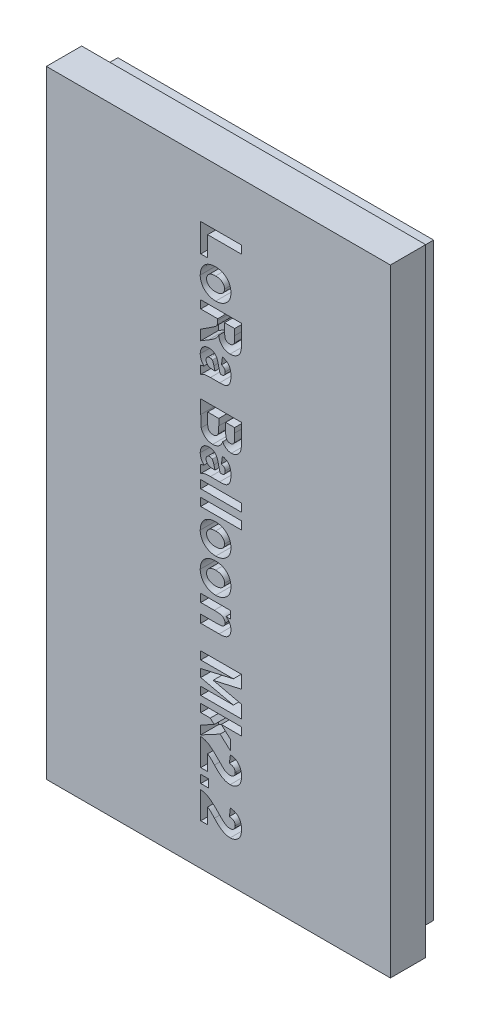
from build123d import *

# Parameters (mm, degrees)
SKETCH1_W   = 39
SKETCH1_H   = 70
BASE_DEPTH  = 4
SKETCH2_W   = 35.8
SKETCH2_H   = 66.8
SKETCH2_W_2 = 32.2
SKETCH2_H_2 = 63.2
MOUNT_DEPTH = 2.5
SKETCH3_W   = 4.622973633
SKETCH3_H   = 0.90057928
SKETCH3_H_2 = 0.900579279
SKETCH3_W_2 = 0.900579279
LOGO_DEPTH  = 2


with BuildPart() as part:
    # Sketch1 → Base (new body)
    with BuildSketch(Plane.XY):
        with Locations((19.5, 35)):
            Rectangle(SKETCH1_W, SKETCH1_H)
    extrude(amount=BASE_DEPTH)

    # Sketch2 → Mount (add)
    with BuildSketch(Plane(origin=(0, 0, 0), x_dir=(-1, 0, 0), z_dir=(0, 0, -1))):
        with Locations((-19.5, 35)):
            Rectangle(SKETCH2_W, SKETCH2_H)
        with Locations((-19.5, 35)):
            Rectangle(SKETCH2_W_2, SKETCH2_H_2, mode=Mode.SUBTRACT)
    extrude(amount=MOUNT_DEPTH)

    # Sketch3 → Logo (cut)
    # profile 1 of 16: a face of its own
    with BuildSketch(Plane.XY.offset(4)):
        Polygon((17.5, 63.519691051), (22.122973633, 63.519691051), (22.122973633, 62.619111772), (18.280502042, 62.619111772), (18.280502042, 60.337644265), (17.5, 60.337644265), align=None)
    # profile 2 of 16: a face of its own
    with BuildSketch(Plane.XY.offset(4)):
        with BuildLine():
            add(Edge.make_bspline(
                [(19.227986492, 59.917373935), (19.268340591, 59.916553667), (19.348241235, 59.914929545), (19.466831788, 59.904980589), (19.582597294, 59.885571908), (19.695714536, 59.860482277), (19.806416527, 59.82895916), (19.913363069, 59.787668503), (20.018572563, 59.741561532), (20.119538873, 59.686551332), (20.216642118, 59.627238007), (20.307982668, 59.562480077), (20.392270804, 59.492505889), (20.471764649, 59.420003428), (20.542963196, 59.340819709), (20.610173753, 59.25914226), (20.668761487, 59.17106248), (20.722741328, 59.080281515), (20.769340893, 58.984958843), (20.810963092, 58.887212626), (20.84421655, 58.785501626), (20.874003462, 58.682243794), (20.895076066, 58.575124144), (20.911226693, 58.46559476), (20.920807626, 58.352789526), (20.921733394, 58.276648926), (20.922201261, 58.23816882)],
                knots=[0, 0, 0, 0, 1.087797627, 2.153826546, 3.204146119, 4.249074796, 5.276002369, 6.302929943, 7.33671768, 8.369955531, 9.399197913, 10.402506754, 11.384561342, 12.350717656, 13.299250364, 14.252266119, 15.199037181, 16.147307724, 17.097187567, 18.056740571, 19.008264324, 19.97962709, 20.951574749, 21.948063114, 22.962987564, 24, 24, 24, 24], degree=3))
            add(Edge.make_bspline(
                [(20.922201261, 58.23816882), (20.920492435, 58.17431076), (20.917163302, 58.049902547), (20.89380331, 57.868435741), (20.853287611, 57.69781183), (20.797267351, 57.536975467), (20.72326136, 57.38733444), (20.634810544, 57.247019053), (20.529143938, 57.117967528), (20.40795289, 57.001818049), (20.277240101, 56.897040623), (20.139130934, 56.806096419), (19.996080966, 56.728621147), (19.847473094, 56.665454644), (19.693540221, 56.615077456), (19.533372162, 56.581373883), (19.368435672, 56.5582934), (19.256523789, 56.556247491), (19.199843389, 56.555211293)],
                knots=[0, 0, 0, 0, 1.136040707, 2.213233445, 3.248238065, 4.25119704, 5.236487175, 6.211911138, 7.196384178, 8.195725979, 9.1931767, 10.173001403, 11.133846892, 12.083513917, 13.042376269, 14.010298635, 14.992269034, 16, 16, 16, 16], degree=3))
            add(Edge.make_bspline(
                [(19.199843389, 56.555211293), (19.157599655, 56.555892607), (19.0738988, 56.557242549), (18.949923499, 56.569225625), (18.828866965, 56.586435452), (18.710806659, 56.612233079), (18.595913097, 56.644512826), (18.484212787, 56.68553559), (18.375843769, 56.733219222), (18.270645012, 56.787374854), (18.171228883, 56.848385325), (18.076479739, 56.912829759), (17.989613644, 56.983498286), (17.908343846, 57.057930632), (17.833120613, 57.136653742), (17.764474284, 57.22039727), (17.702322369, 57.308790164), (17.647348245, 57.401571301), (17.598380596, 57.497418925), (17.556075444, 57.596143647), (17.52061437, 57.69714263), (17.49154767, 57.800282717), (17.4673821, 57.905319168), (17.452433072, 58.013337566), (17.441007522, 58.123164342), (17.440311587, 58.197173674), (17.439961381, 58.234416407)],
                knots=[0, 0, 0, 0, 1.117558833, 2.214307803, 3.293244786, 4.351421184, 5.409597582, 6.448807362, 7.497331125, 8.540978692, 9.576922014, 10.582241184, 11.570837346, 12.537122916, 13.496974449, 14.449450387, 15.399839374, 16.353464778, 17.300823134, 18.246083241, 19.193441597, 20.131138339, 21.080698472, 22.042616426, 23.015011865, 24, 24, 24, 24], degree=3))
            add(Edge.make_bspline(
                [(17.439961381, 58.234416407), (17.441434818, 58.293581477), (17.444329398, 58.409811804), (17.466190044, 58.580403837), (17.502637169, 58.743113282), (17.553836141, 58.89819662), (17.618260134, 59.046016275), (17.698440035, 59.185734774), (17.79447105, 59.316576164), (17.902499007, 59.440250702), (18.024251963, 59.553385074), (18.159878703, 59.651084335), (18.308067385, 59.733312239), (18.468125433, 59.800916368), (18.640780217, 59.853364958), (18.825794291, 59.890561403), (19.022910429, 59.913321598), (19.158504181, 59.916000953), (19.227986492, 59.917373935)],
                knots=[0, 0, 0, 0, 1.024594995, 2.012826322, 2.973358778, 3.908543225, 4.837401023, 5.761810751, 6.69243552, 7.644223827, 8.602462928, 9.564551743, 10.532007457, 11.531954493, 12.568505162, 13.651979317, 14.796803673, 16, 16, 16, 16], degree=3))
        make_face()
        with BuildLine():
            add(Edge.make_bspline(
                [(19.181081321, 59.016794656), (19.140418132, 59.015985767), (19.061457429, 59.014415049), (18.946509384, 59.004834622), (18.839622498, 58.985121553), (18.739486697, 58.962179728), (18.647961982, 58.928237045), (18.563118232, 58.889661344), (18.486368037, 58.842211129), (18.418159022, 58.787894592), (18.358227437, 58.728430958), (18.305063926, 58.666277416), (18.260023454, 58.601076499), (18.223835025, 58.532291004), (18.195763008, 58.46081815), (18.174765469, 58.386120438), (18.162389452, 58.308317825), (18.161082475, 58.255410656), (18.160424805, 58.228787786)],
                knots=[0, 0, 0, 0, 1.347985487, 2.617548842, 3.817114289, 4.948286482, 6.017057593, 7.046407217, 8.032969353, 8.999289909, 9.930051738, 10.827140183, 11.706817169, 12.550594062, 13.397420762, 14.247349517, 15.118066881, 16, 16, 16, 16], degree=3))
            add(Edge.make_bspline(
                [(18.160424805, 58.228787786), (18.161082172, 58.202789107), (18.162388524, 58.151123318), (18.174768649, 58.075184814), (18.195758212, 58.002347429), (18.224167513, 57.93213144), (18.260561859, 57.864498818), (18.306359128, 57.800600759), (18.359147439, 57.739085743), (18.42010437, 57.68129455), (18.488357165, 57.627164406), (18.565874129, 57.581398416), (18.650982245, 57.542984668), (18.743354127, 57.51120928), (18.843361939, 57.485665346), (18.951359004, 57.468256351), (19.067059726, 57.458032174), (19.146662829, 57.456552441), (19.187648045, 57.455790572)],
                knots=[0, 0, 0, 0, 0.86498205, 1.718932724, 2.552529207, 3.383717481, 4.236080589, 5.102502034, 5.995588818, 6.930639414, 7.894730959, 8.889086482, 9.918564038, 10.998334367, 12.1369617, 13.350269694, 14.635734454, 16, 16, 16, 16], degree=3))
            add(Edge.make_bspline(
                [(19.187648045, 57.455790572), (19.227688932, 57.456588782), (19.305407142, 57.458138086), (19.418448526, 57.467853118), (19.523973479, 57.487150925), (19.622320571, 57.511914829), (19.713524667, 57.543985128), (19.797316766, 57.58327715), (19.873991238, 57.630272105), (19.942107737, 57.685034462), (20.003044034, 57.743795675), (20.055828048, 57.806243808), (20.101619145, 57.87108965), (20.138009283, 57.939653741), (20.166408615, 58.010806032), (20.187393837, 58.084578407), (20.199774112, 58.161447567), (20.201080471, 58.21373417), (20.201737837, 58.240045027)],
                knots=[0, 0, 0, 0, 1.337232047, 2.595528913, 3.783536199, 4.915617704, 5.97906533, 7.006690339, 8.000659516, 8.974235141, 9.919454987, 10.823278711, 11.700968276, 12.565199868, 13.408680491, 14.254935835, 15.121875735, 16, 16, 16, 16], degree=3))
            add(Edge.make_bspline(
                [(20.201737837, 58.240045027), (20.201125638, 58.266363218), (20.199923414, 58.318046388), (20.187117275, 58.394207937), (20.1666105, 58.467170456), (20.137959369, 58.53762355), (20.10165055, 58.605310335), (20.055496899, 58.669222471), (20.003354012, 58.731596732), (19.942036507, 58.789412202), (19.873587127, 58.843503766), (19.796542842, 58.889985729), (19.712370979, 58.929796557), (19.620397249, 58.961484494), (19.521262796, 58.98667956), (19.414268616, 59.004448634), (19.300102491, 59.014500587), (19.221439565, 59.016016772), (19.181081321, 59.016794656)],
                knots=[0, 0, 0, 0, 0.8777483, 1.723705717, 2.56959874, 3.403036217, 4.257705828, 5.126471818, 6.029908573, 6.967489424, 7.934189811, 8.936630112, 9.963815147, 11.036651848, 12.178360317, 13.374360467, 14.652907978, 16, 16, 16, 16], degree=3))
        make_face(mode=Mode.SUBTRACT)
    # profile 3 of 16: a face of its own
    with BuildSketch(Plane.XY.offset(4)):
        with BuildLine():
            Line((17.5, 55.834747869), (22.122973633, 55.834747869))
            Line((22.122973633, 55.834747869), (22.122973633, 53.931336039))
            add(Edge.make_bspline(
                [(22.122973633, 53.931336039), (22.122603462, 53.872546069), (22.121890503, 53.759314846), (22.116763364, 53.595968956), (22.105883787, 53.445890968), (22.093695487, 53.308683291), (22.075788291, 53.184747794), (22.054389036, 53.07355638), (22.02973767, 52.975250916), (21.991190656, 52.86232027), (21.927918547, 52.73590191), (21.829831137, 52.599074998), (21.709116511, 52.475953385), (21.591346034, 52.386968918), (21.487257539, 52.325280846), (21.404923358, 52.283439484), (21.317857299, 52.250098354), (21.227356033, 52.221689731), (21.133020602, 52.199279165), (21.034598303, 52.183293809), (20.932711672, 52.173783072), (20.863433738, 52.17285937), (20.828390919, 52.172392134)],
                knots=[0, 0, 0, 0, 1.403336213, 2.702867097, 3.89994726, 4.994709233, 5.990128961, 6.887471613, 7.696701944, 8.407207329, 9.732421867, 11.053910544, 12.410433107, 13.833109191, 14.562763883, 15.297137368, 16.03453921, 16.78526912, 17.560138056, 18.346710252, 19.163717375, 20, 20, 20, 20], degree=3))
            add(Edge.make_bspline(
                [(20.828390919, 52.172392134), (20.784249276, 52.173152122), (20.697885971, 52.17463904), (20.571821786, 52.19038499), (20.45195708, 52.21403639), (20.339297604, 52.249508681), (20.231984451, 52.291952276), (20.132497639, 52.347135765), (20.039105913, 52.411113631), (19.952432097, 52.48444969), (19.87351831, 52.567423037), (19.802330467, 52.658794234), (19.737810759, 52.757581763), (19.682936532, 52.865615406), (19.633581682, 52.98093702), (19.593807931, 53.105487545), (19.560681473, 53.237717693), (19.545373295, 53.32925955), (19.537560619, 53.375978817)],
                knots=[0, 0, 0, 0, 1.084141299, 2.12112686, 3.117250271, 4.082180618, 5.019674211, 5.948149429, 6.871043381, 7.797863675, 8.732676681, 9.679570512, 10.640822351, 11.627176691, 12.653315453, 13.72007994, 14.836420889, 16, 16, 16, 16], degree=3))
            add(Edge.make_bspline(
                [(19.537560619, 53.375978817), (19.508484087, 53.327420021), (19.451853997, 53.232845847), (19.358336472, 53.100939278), (19.261317569, 52.981707751), (19.174212653, 52.890871561), (19.097310292, 52.821625001), (19.0295238, 52.766448195), (18.951540268, 52.707420675), (18.862838653, 52.644481945), (18.763722605, 52.577189453), (18.653874446, 52.505987708), (18.533375015, 52.430769254), (18.449117336, 52.379912075), (18.405269796, 52.353446093)],
                knots=[0, 0, 0, 0, 1.316447784, 2.563942512, 3.758196669, 4.89017242, 5.487731481, 6.164970468, 6.923081098, 7.76291089, 8.695186333, 9.710230341, 10.808408125, 12, 12, 12, 12], degree=3))
            Line((18.405269796, 52.353446093), (17.5, 51.812160423))
            Line((17.5, 51.812160423), (17.5, 52.95383228))
            Line((17.5, 52.95383228), (18.495327724, 53.594556913))
            add(Edge.make_bspline(
                [(18.495327724, 53.594556913), (18.538170903, 53.622381996), (18.619855584, 53.675433219), (18.736113095, 53.751052306), (18.839709613, 53.820173631), (18.931509766, 53.880939595), (19.009413932, 53.937271757), (19.075916224, 53.984397728), (19.12987976, 54.024862821), (19.184272621, 54.068912267), (19.238866246, 54.121356183), (19.293796286, 54.18457256), (19.336920929, 54.250578408), (19.370530988, 54.321019242), (19.39451614, 54.403545626), (19.410428062, 54.503019432), (19.418952624, 54.622883951), (19.420435996, 54.709323008), (19.421235795, 54.755928941)],
                knots=[0, 0, 0, 0, 1.540630534, 2.937361724, 4.182336204, 5.296545873, 6.256860607, 7.081241145, 7.754565199, 8.290682583, 9.191113071, 10.033949391, 10.810788607, 11.561665679, 12.379113064, 13.39303176, 14.594383257, 16, 16, 16, 16], degree=3))
            Line((19.421235795, 54.755928941), (19.421235795, 54.93416859))
            Line((19.421235795, 54.93416859), (17.5, 54.93416859))
            Line((17.5, 54.93416859), (17.5, 55.834747869))
        make_face()
        with BuildLine():
            Line((20.201737837, 54.93416859), (20.201737837, 54.273743786))
            add(Edge.make_bspline(
                [(20.201737837, 54.273743786), (20.201999563, 54.225587847), (20.20249754, 54.133962899), (20.203997976, 54.003230593), (20.207918581, 53.886279269), (20.212519213, 53.783074596), (20.217812844, 53.693574506), (20.224943188, 53.617787775), (20.23420104, 53.555806365), (20.24734485, 53.49201719), (20.271407064, 53.424655662), (20.311858966, 53.353327902), (20.361639607, 53.288286701), (20.424349944, 53.232785424), (20.498156922, 53.186888836), (20.583996569, 53.155374934), (20.680596319, 53.136459226), (20.748558268, 53.134198807), (20.784300059, 53.133010032)],
                knots=[0, 0, 0, 0, 1.560937284, 2.96995135, 4.237567709, 5.353650601, 6.318464703, 7.143454388, 7.820048429, 8.348858403, 9.25293029, 10.124191563, 10.998043079, 11.895328271, 12.823620657, 13.798761283, 14.842349086, 16, 16, 16, 16], degree=3))
            add(Edge.make_bspline(
                [(20.784300059, 53.133010032), (20.81847221, 53.134245883), (20.883936766, 53.136613436), (20.976941065, 53.155158092), (21.059506611, 53.187182262), (21.130758936, 53.23301968), (21.191421011, 53.289971409), (21.24112854, 53.356768373), (21.282982152, 53.431399448), (21.299994907, 53.486582477), (21.308699868, 53.514818122)],
                knots=[0, 0, 0, 0, 1.164311867, 2.230505154, 3.21629184, 4.165493112, 5.100643873, 6.036584124, 6.995373831, 8, 8, 8, 8], degree=3))
            add(Edge.make_bspline(
                [(21.308699868, 53.514818122), (21.311320199, 53.527617067), (21.317551044, 53.558051486), (21.324877556, 53.611570435), (21.329832618, 53.679873062), (21.334583807, 53.762748434), (21.338086886, 53.860333551), (21.341182461, 53.972906446), (21.341427788, 54.100196665), (21.342111742, 54.189940649), (21.342471591, 54.237157752)],
                knots=[0, 0, 0, 0, 0.432971861, 1.029557334, 1.788740938, 2.702316591, 3.781055348, 5.025222918, 6.434877167, 8, 8, 8, 8], degree=3))
            Line((21.342471591, 54.237157752), (21.342471591, 54.93416859))
            Line((21.342471591, 54.93416859), (20.201737837, 54.93416859))
        make_face(mode=Mode.SUBTRACT)
    # profile 4 of 16: a face of its own
    with BuildSketch(Plane.XY.offset(4)):
        with BuildLine():
            Line((19.841506126, 50.61138805), (19.961583363, 51.451928711))
            add(Edge.make_bspline(
                [(19.961583363, 51.451928711), (20.003056427, 51.440020111), (20.08373433, 51.416854211), (20.198162111, 51.373136266), (20.30438426, 51.325709527), (20.401073835, 51.270902191), (20.489620864, 51.211489282), (20.568113139, 51.144980211), (20.637964286, 51.07344571), (20.699606916, 50.99601388), (20.752828321, 50.910954703), (20.798705368, 50.817942481), (20.837141958, 50.716108782), (20.867740873, 50.60578658), (20.892075182, 50.486988816), (20.909807303, 50.359486045), (20.919932697, 50.223177629), (20.921430674, 50.129532389), (20.922201261, 50.081359621)],
                knots=[0, 0, 0, 0, 1.125515524, 2.189474865, 3.193709533, 4.158305409, 5.086274303, 5.972285183, 6.837881566, 7.691743787, 8.549806887, 9.451203831, 10.393874208, 11.385866739, 12.435713252, 13.556277782, 14.742906037, 16, 16, 16, 16], degree=3))
            add(Edge.make_bspline(
                [(20.922201261, 50.081359621), (20.921986052, 50.038506543), (20.921567926, 49.9552477), (20.914195236, 49.834230246), (20.905701633, 49.720830457), (20.891648419, 49.615270623), (20.872802431, 49.517635474), (20.850656262, 49.42762641), (20.824366297, 49.345482), (20.785361186, 49.248588079), (20.72686919, 49.141789781), (20.645227411, 49.029792983), (20.550150903, 48.93865795), (20.460504459, 48.877402987), (20.378336951, 48.83955966), (20.305144759, 48.816000272), (20.220833774, 48.79526852), (20.12519058, 48.778860098), (20.01811083, 48.765903154), (19.899799318, 48.756781831), (19.770265296, 48.75115149), (19.680158536, 48.750519763), (19.633247167, 48.750190874)],
                knots=[0, 0, 0, 0, 1.172645795, 2.278322549, 3.317437237, 4.284552983, 5.190951134, 6.037858116, 6.820064311, 7.549551753, 8.893788561, 10.141635195, 11.328036199, 12.481663495, 13.094362176, 13.79803918, 14.582676335, 15.469136844, 16.45214095, 17.533908717, 18.716103928, 20, 20, 20, 20], degree=3))
            Line((19.633247167, 48.750190874), (18.599457203, 48.757695701))
            add(Edge.make_bspline(
                [(18.599457203, 48.757695701), (18.564435728, 48.757403719), (18.496576972, 48.756837966), (18.398330909, 48.755681196), (18.307040045, 48.750474743), (18.222621106, 48.744792865), (18.144878475, 48.739106667), (18.074326469, 48.729015709), (18.010639761, 48.719369923), (17.934153527, 48.702680168), (17.841504636, 48.67487694), (17.729923806, 48.631472915), (17.614669352, 48.576902525), (17.539082625, 48.532826305), (17.5, 48.510036399)],
                knots=[0, 0, 0, 0, 1.100960395, 2.13325684, 3.08799504, 3.974623839, 4.793377983, 5.537123068, 6.214225653, 6.817686965, 7.996461938, 9.250537039, 10.578371695, 12, 12, 12, 12], degree=3))
            Line((17.5, 48.510036399), (17.5, 49.410615678))
            Line((17.5, 49.410615678), (17.867736539, 49.520373778))
            add(Edge.make_bspline(
                [(17.867736539, 49.520373778), (17.83226304, 49.556591272), (17.763238807, 49.627063168), (17.674416477, 49.742170854), (17.599695505, 49.860344522), (17.540260444, 49.983200312), (17.494849843, 50.10999856), (17.463178517, 50.240511108), (17.443827041, 50.375032633), (17.441261018, 50.465917722), (17.439961381, 50.511949088)],
                knots=[0, 0, 0, 0, 1.094238684, 2.129166538, 3.133671034, 4.10942336, 5.070833053, 6.037377746, 7.005973528, 8, 8, 8, 8], degree=3))
            add(Edge.make_bspline(
                [(17.439961381, 50.511949088), (17.441007341, 50.549813025), (17.443061457, 50.624172367), (17.454903777, 50.733206179), (17.476538098, 50.836821689), (17.507054288, 50.934832823), (17.543951561, 51.028430924), (17.591661801, 51.116031558), (17.646964549, 51.198837941), (17.71053094, 51.275834447), (17.781922723, 51.344520407), (17.857738316, 51.406912183), (17.941277911, 51.456774609), (18.028844016, 51.500371802), (18.123266364, 51.531264195), (18.222597532, 51.555303125), (18.327631273, 51.569376344), (18.399600412, 51.571119046), (18.436227209, 51.572005948)],
                knots=[0, 0, 0, 0, 1.111028414, 2.181900458, 3.212888925, 4.21115239, 5.190734394, 6.159429897, 7.131421471, 8.108723925, 9.081883785, 10.034678926, 10.981892532, 11.929727932, 12.898727489, 13.888948844, 14.925636122, 16, 16, 16, 16], degree=3))
            add(Edge.make_bspline(
                [(18.436227209, 51.572005948), (18.482593242, 51.570570747), (18.572724924, 51.567780835), (18.703283791, 51.545991429), (18.824622959, 51.509589158), (18.936022841, 51.457337912), (19.037479655, 51.39257465), (19.129142785, 51.315722556), (19.208842276, 51.225745591), (19.267148448, 51.141322735), (19.309753926, 51.065822541), (19.338835724, 50.999600706), (19.369441505, 50.926842835), (19.396985309, 50.845322297), (19.425368881, 50.756348095), (19.452494502, 50.659084561), (19.4774731, 50.553428176), (19.493569489, 50.48038811), (19.501912689, 50.442529436)],
                knots=[0, 0, 0, 0, 1.294162278, 2.515743014, 3.684113667, 4.820865117, 5.939906549, 7.036651616, 8.149715676, 9.285662014, 9.895437351, 10.567486448, 11.303637924, 12.098932185, 12.968810962, 13.91153998, 14.917493754, 16, 16, 16, 16], degree=3))
            add(Edge.make_bspline(
                [(19.501912689, 50.442529436), (19.511407002, 50.396831191), (19.529650374, 50.309021778), (19.559131352, 50.183149311), (19.587017816, 50.068002884), (19.61413993, 49.963436659), (19.640930358, 49.869757609), (19.668501435, 49.787074691), (19.694085633, 49.714833804), (19.712787099, 49.671017361), (19.721428888, 49.650770153)],
                knots=[0, 0, 0, 0, 1.361164628, 2.615484881, 3.770095419, 4.816364149, 5.765912261, 6.610903979, 7.358110453, 8, 8, 8, 8], degree=3))
            add(Edge.make_bspline(
                [(19.721428888, 49.650770153), (19.76207844, 49.651429427), (19.835936364, 49.652627291), (19.93546068, 49.657961407), (20.012171286, 49.66950181), (20.070146149, 49.685642352), (20.113156329, 49.712229682), (20.150196809, 49.74408205), (20.18179134, 49.785492699), (20.210776693, 49.83420177), (20.234039299, 49.892955807), (20.250744994, 49.962036374), (20.259418855, 50.041742371), (20.260957962, 50.098226609), (20.261776456, 50.128264791)],
                knots=[0, 0, 0, 0, 1.704637254, 3.09722893, 4.172654963, 4.956246112, 5.596985007, 6.275246559, 6.99385986, 7.769515704, 8.645866914, 9.631493719, 10.740434052, 12, 12, 12, 12], degree=3))
            add(Edge.make_bspline(
                [(20.261776456, 50.128264791), (20.260884607, 50.159017067), (20.25919465, 50.217289276), (20.241526382, 50.299374461), (20.215410217, 50.372126763), (20.174002857, 50.43472478), (20.117664666, 50.489569205), (20.042764104, 50.536922131), (19.949087652, 50.578793394), (19.879011929, 50.60002468), (19.841506126, 50.61138805)],
                knots=[0, 0, 0, 0, 1.045871977, 1.981813381, 2.848317391, 3.663751395, 4.514929533, 5.507645304, 6.666046366, 8, 8, 8, 8], degree=3))
        make_face()
        with BuildLine():
            add(Edge.make_bspline(
                [(19.121042702, 49.650770153), (19.111478433, 49.678227344), (19.090198568, 49.739317777), (19.059474829, 49.841940313), (19.027018533, 49.965053874), (19.005193715, 50.054117219), (18.993460638, 50.101997896)],
                knots=[0, 0, 0, 0, 0.743632693, 1.654533494, 2.73907137, 4, 4, 4, 4], degree=3))
            add(Edge.make_bspline(
                [(18.993460638, 50.101997896), (18.98653897, 50.130215888), (18.97332241, 50.184096661), (18.950053418, 50.260430744), (18.928514853, 50.329717913), (18.904326783, 50.390991339), (18.881777826, 50.445420249), (18.857166421, 50.491799098), (18.832210074, 50.530622659), (18.813567384, 50.552457403), (18.804901851, 50.562606673)],
                knots=[0, 0, 0, 0, 1.388607462, 2.65147299, 3.814389992, 4.855436495, 5.799565367, 6.62877246, 7.362623276, 8, 8, 8, 8], degree=3))
            add(Edge.make_bspline(
                [(18.804901851, 50.562606673), (18.787150786, 50.579491216), (18.752087496, 50.612842884), (18.686643373, 50.646727282), (18.614581201, 50.668200293), (18.563658271, 50.670332939), (18.537542378, 50.671426669)],
                knots=[0, 0, 0, 0, 0.985740837, 1.947112291, 2.947173789, 4, 4, 4, 4], degree=3))
            add(Edge.make_bspline(
                [(18.537542378, 50.671426669), (18.50766342, 50.670137856), (18.449801672, 50.667642019), (18.366786442, 50.643682117), (18.290760217, 50.606342092), (18.224593068, 50.553149627), (18.168585191, 50.490429239), (18.129814521, 50.416483471), (18.103890852, 50.33606052), (18.101569181, 50.279194172), (18.100386186, 50.250218235)],
                knots=[0, 0, 0, 0, 1.056198986, 2.045369905, 3.036276429, 4.038084886, 5.035473036, 5.992159802, 6.976916006, 8, 8, 8, 8], degree=3))
            add(Edge.make_bspline(
                [(18.100386186, 50.250218235), (18.101736527, 50.223223501), (18.104453435, 50.16890965), (18.124157539, 50.087854462), (18.156784545, 50.007731894), (18.200051148, 49.929484378), (18.252073425, 49.8576195), (18.311090427, 49.79663157), (18.374225547, 49.747093123), (18.432190619, 49.715163813), (18.484079963, 49.69628429), (18.530121172, 49.684823766), (18.5827991, 49.672932093), (18.642798398, 49.665245914), (18.709733915, 49.658557856), (18.78390109, 49.654068826), (18.865230729, 49.651253864), (18.921849407, 49.650935466), (18.951245984, 49.650770153)],
                knots=[0, 0, 0, 0, 1.093500888, 2.200141778, 3.360346716, 4.591280596, 5.815607582, 6.94487563, 8.019710678, 9.057444999, 9.610729159, 10.253199895, 10.979011171, 11.798077413, 12.702238226, 13.705425431, 14.808650418, 16, 16, 16, 16], degree=3))
            Line((18.951245984, 49.650770153), (19.121042702, 49.650770153))
        make_face(mode=Mode.SUBTRACT)
    # profile 5 of 16: a face of its own
    with BuildSketch(Plane.XY.offset(4)):
        with BuildLine():
            Line((22.122973633, 46.108491655), (22.122973633, 44.281066201))
            add(Edge.make_bspline(
                [(22.122973633, 44.281066201), (22.122521051, 44.221026579), (22.121651102, 44.105618856), (22.117632998, 43.939162972), (22.108005759, 43.786847256), (22.095757541, 43.648294778), (22.081840746, 43.523482495), (22.061533426, 43.412540908), (22.040180572, 43.315039471), (22.0049456, 43.204537428), (21.948462842, 43.080188598), (21.859088002, 42.944827325), (21.748544411, 42.821243994), (21.640427701, 42.730695394), (21.545807025, 42.665898527), (21.471963858, 42.622291391), (21.394724771, 42.586831753), (21.315529677, 42.557950869), (21.2346417, 42.533594529), (21.150572045, 42.51855641), (21.064475175, 42.507225139), (21.006044505, 42.506526476), (20.976611259, 42.506174538)],
                knots=[0, 0, 0, 0, 1.498327689, 2.88007457, 4.154414764, 5.305986542, 6.351317343, 7.286582663, 8.11946184, 8.840080679, 10.177555878, 11.512935148, 12.872513647, 14.301275782, 15.019863751, 15.733221227, 16.438466007, 17.137161526, 17.836031326, 18.543086972, 19.26611006, 20, 20, 20, 20], degree=3))
            add(Edge.make_bspline(
                [(20.976611259, 42.506174538), (20.922946761, 42.508244761), (20.817024149, 42.512330951), (20.662821857, 42.547652419), (20.51596526, 42.603079791), (20.380113254, 42.682270405), (20.256588311, 42.778484715), (20.148778926, 42.889289753), (20.056681459, 43.012718845), (20.011500867, 43.104508485), (19.988788362, 43.150651585)],
                knots=[0, 0, 0, 0, 1.031817477, 2.036594177, 3.029254201, 4.043130586, 5.050931669, 6.034203586, 7.01178454, 8, 8, 8, 8], degree=3))
            add(Edge.make_bspline(
                [(19.988788362, 43.150651585), (19.978291223, 43.119218071), (19.957542489, 43.057086323), (19.919057509, 42.967929238), (19.874445181, 42.88431553), (19.826159834, 42.80476423), (19.770442173, 42.731859613), (19.709973461, 42.664103109), (19.645321829, 42.600321355), (19.573797837, 42.544037104), (19.499063042, 42.491579361), (19.418797393, 42.447838091), (19.335071516, 42.410185621), (19.247401209, 42.378753037), (19.155229507, 42.355750252), (19.059306459, 42.33888402), (18.959608937, 42.328333414), (18.891858621, 42.326825057), (18.857435643, 42.326058683)],
                knots=[0, 0, 0, 0, 1.053917501, 2.08318216, 3.084375989, 4.067115349, 5.039987852, 5.998256831, 6.954975631, 7.924383767, 8.890110205, 9.856297623, 10.826929889, 11.808561028, 12.814635272, 13.844956918, 14.905053061, 16, 16, 16, 16], degree=3))
            add(Edge.make_bspline(
                [(18.857435643, 42.326058683), (18.815500063, 42.327003794), (18.733295748, 42.328856452), (18.612472135, 42.342119765), (18.496620731, 42.364499356), (18.385911071, 42.396523304), (18.279951486, 42.436913818), (18.179119697, 42.486864589), (18.083315073, 42.546315283), (17.992730779, 42.613589789), (17.90919217, 42.686948542), (17.833589227, 42.76465437), (17.765489185, 42.844869725), (17.707581308, 42.930073546), (17.656528591, 43.017258222), (17.61374927, 43.107736452), (17.581005615, 43.201992388), (17.565164633, 43.26652488), (17.557224308, 43.298871925)],
                knots=[0, 0, 0, 0, 1.145607172, 2.24567906, 3.316329682, 4.365460088, 5.390414304, 6.410550385, 7.434792233, 8.46684308, 9.489944109, 10.468671886, 11.426900475, 12.36059261, 13.279351643, 14.185149476, 15.09030244, 16, 16, 16, 16], degree=3))
            add(Edge.make_bspline(
                [(17.557224308, 43.298871925), (17.552629506, 43.325417983), (17.542179673, 43.385790953), (17.530238938, 43.48844883), (17.521967062, 43.613706564), (17.512784829, 43.761568824), (17.508239794, 43.932081832), (17.503113461, 44.125314849), (17.500511164, 44.34109826), (17.500175925, 44.492451827), (17.5, 44.57187826)],
                knots=[0, 0, 0, 0, 0.506837559, 1.152686718, 1.943271314, 2.868501158, 3.939884368, 5.152247396, 6.505573166, 8, 8, 8, 8], degree=3))
            Line((17.5, 44.57187826), (17.5, 46.108491655))
            Line((17.5, 46.108491655), (22.122973633, 46.108491655))
        make_face()
        with BuildLine():
            Line((21.342471591, 45.207912376), (20.321815075, 45.207912376))
            Line((20.321815075, 45.207912376), (20.321815075, 44.594392742))
            add(Edge.make_bspline(
                [(20.321815075, 44.594392742), (20.321708304, 44.55061401), (20.321505436, 44.467433178), (20.322860414, 44.349236777), (20.323271951, 44.244155796), (20.325612076, 44.152236417), (20.326868369, 44.073713296), (20.330184865, 44.008391975), (20.332255296, 43.956085536), (20.33545221, 43.925515906), (20.336824729, 43.912391559)],
                knots=[0, 0, 0, 0, 1.539755574, 2.925579234, 4.157432792, 5.235486124, 6.159601295, 6.919197766, 7.535983151, 8, 8, 8, 8], degree=3))
            add(Edge.make_bspline(
                [(20.336824729, 43.912391559), (20.342990913, 43.874641455), (20.354742688, 43.802695703), (20.388025395, 43.701846174), (20.433788831, 43.614182948), (20.491801151, 43.538937987), (20.562445267, 43.478974229), (20.646094328, 43.436974564), (20.740542137, 43.410987644), (20.807575483, 43.408203042), (20.84246247, 43.406753817)],
                knots=[0, 0, 0, 0, 1.156043088, 2.203236031, 3.197816213, 4.134692963, 5.061434266, 5.975433912, 6.946330216, 8, 8, 8, 8], degree=3))
            add(Edge.make_bspline(
                [(20.84246247, 43.406753817), (20.873876263, 43.407765583), (20.934019538, 43.409702659), (21.019351721, 43.431386426), (21.096016804, 43.464879192), (21.161935885, 43.513564177), (21.216357618, 43.571749905), (21.262093272, 43.635170819), (21.293723027, 43.705544152), (21.3117268, 43.770575939), (21.321477076, 43.833977643), (21.325841476, 43.900183126), (21.332380205, 43.98452942), (21.334869957, 44.08688744), (21.339580253, 44.207545593), (21.340377663, 44.346113349), (21.343094236, 44.5027625), (21.342686451, 44.613153063), (21.342471591, 44.671317222)],
                knots=[0, 0, 0, 0, 0.973031789, 1.862917975, 2.714444411, 3.555113712, 4.385861934, 5.180259999, 5.970734499, 6.766732084, 7.267820327, 7.959442945, 8.825288207, 9.893716152, 11.136763095, 12.573466007, 14.194578749, 16, 16, 16, 16], degree=3))
            Line((21.342471591, 44.671317222), (21.342471591, 45.207912376))
        make_face(mode=Mode.SUBTRACT)
        with BuildLine():
            Line((19.541313033, 45.207912376), (18.280502042, 45.207912376))
            Line((18.280502042, 45.207912376), (18.280502042, 44.367371715))
            add(Edge.make_bspline(
                [(18.280502042, 44.367371715), (18.280760428, 44.323280795), (18.281253401, 44.239160195), (18.282800025, 44.11937151), (18.286518536, 44.01209175), (18.291887116, 43.916971468), (18.299557696, 43.834126401), (18.307251331, 43.763556455), (18.317857629, 43.70572466), (18.331738252, 43.644979433), (18.35944942, 43.580071948), (18.402845831, 43.510176577), (18.458232543, 43.446158643), (18.525607831, 43.390276991), (18.604204685, 43.343759319), (18.693207476, 43.30987147), (18.79246554, 43.290066164), (18.861720576, 43.287837041), (18.897774089, 43.28667658)],
                knots=[0, 0, 0, 0, 1.468823539, 2.802352852, 3.990613231, 5.044577628, 5.97542194, 6.762296442, 7.407977832, 7.933490854, 8.834961323, 9.742609811, 10.665728169, 11.642033707, 12.646065455, 13.694610711, 14.799836276, 16, 16, 16, 16], degree=3))
            add(Edge.make_bspline(
                [(18.897774089, 43.28667658), (18.93476601, 43.288172532), (19.005924698, 43.291050187), (19.107872413, 43.311463924), (19.199388257, 43.34738452), (19.279963622, 43.397906582), (19.349625379, 43.459908308), (19.407243483, 43.532310286), (19.454309014, 43.613210713), (19.482516024, 43.689669667), (19.49973763, 43.760283467), (19.510234486, 43.826232908), (19.521102124, 43.904014), (19.527554048, 43.994593036), (19.534829997, 44.097100853), (19.5376358, 44.212266537), (19.540957195, 44.339522346), (19.541190876, 44.42865785), (19.541313033, 44.475253608)],
                knots=[0, 0, 0, 0, 1.143215143, 2.19912046, 3.197116365, 4.165365694, 5.123819291, 6.065802965, 7.014162653, 8.005206416, 8.5725482, 9.259043701, 10.068343003, 10.999502645, 12.064921609, 13.244816419, 14.559722402, 16, 16, 16, 16], degree=3))
            Line((19.541313033, 44.475253608), (19.541313033, 45.207912376))
        make_face(mode=Mode.SUBTRACT)
    # profile 6 of 16: a face of its own
    with BuildSketch(Plane.XY.offset(4)):
        with BuildLine():
            Line((19.841506126, 40.885131836), (19.961583363, 41.725672496))
            add(Edge.make_bspline(
                [(19.961583363, 41.725672496), (20.003056427, 41.713763896), (20.08373433, 41.690597996), (20.198162111, 41.646880052), (20.30438426, 41.599453313), (20.401073835, 41.544645976), (20.489620864, 41.485233068), (20.568113139, 41.418723997), (20.637964286, 41.347189496), (20.699606916, 41.269757665), (20.752828321, 41.184698488), (20.798705368, 41.091686266), (20.837141958, 40.989852568), (20.867740873, 40.879530366), (20.892075182, 40.760732601), (20.909807303, 40.633229831), (20.919932697, 40.496921414), (20.921430674, 40.403276175), (20.922201261, 40.355103406)],
                knots=[0, 0, 0, 0, 1.125515524, 2.189474865, 3.193709533, 4.158305409, 5.086274303, 5.972285183, 6.837881566, 7.691743787, 8.549806887, 9.451203831, 10.393874208, 11.385866739, 12.435713252, 13.556277782, 14.742906037, 16, 16, 16, 16], degree=3))
            add(Edge.make_bspline(
                [(20.922201261, 40.355103406), (20.921986052, 40.312250329), (20.921567926, 40.228991485), (20.914195236, 40.107974031), (20.905701633, 39.994574243), (20.891648419, 39.889014409), (20.872802431, 39.79137926), (20.850656262, 39.701370195), (20.824366297, 39.619225785), (20.785361186, 39.522331864), (20.72686919, 39.415533566), (20.645227411, 39.303536769), (20.550150903, 39.212401735), (20.460504459, 39.151146773), (20.378336951, 39.113303446), (20.305144759, 39.089744058), (20.220833774, 39.069012306), (20.12519058, 39.052603883), (20.01811083, 39.039646939), (19.899799318, 39.030525616), (19.770265296, 39.024895276), (19.680158536, 39.024263549), (19.633247167, 39.023934659)],
                knots=[0, 0, 0, 0, 1.172645795, 2.278322549, 3.317437237, 4.284552983, 5.190951134, 6.037858116, 6.820064311, 7.549551753, 8.893788561, 10.141635195, 11.328036199, 12.481663495, 13.094362176, 13.79803918, 14.582676335, 15.469136844, 16.45214095, 17.533908717, 18.716103928, 20, 20, 20, 20], degree=3))
            Line((19.633247167, 39.023934659), (18.599457203, 39.031439486))
            add(Edge.make_bspline(
                [(18.599457203, 39.031439486), (18.564435728, 39.031147505), (18.496576972, 39.030581752), (18.398330909, 39.029424982), (18.307040045, 39.024218529), (18.222621106, 39.01853665), (18.144878475, 39.012850452), (18.074326469, 39.002759494), (18.010639761, 38.993113708), (17.934153527, 38.976423954), (17.841504636, 38.948620726), (17.729923806, 38.9052167), (17.614669352, 38.85064631), (17.539082625, 38.80657009), (17.5, 38.783780185)],
                knots=[0, 0, 0, 0, 1.100960395, 2.13325684, 3.08799504, 3.974623839, 4.793377983, 5.537123068, 6.214225653, 6.817686965, 7.996461938, 9.250537039, 10.578371695, 12, 12, 12, 12], degree=3))
            Line((17.5, 38.783780185), (17.5, 39.684359464))
            Line((17.5, 39.684359464), (17.867736539, 39.794117563))
            add(Edge.make_bspline(
                [(17.867736539, 39.794117563), (17.83226304, 39.830335057), (17.763238807, 39.900806954), (17.674416477, 40.015914639), (17.599695505, 40.134088308), (17.540260444, 40.256944098), (17.494849843, 40.383742345), (17.463178517, 40.514254893), (17.443827041, 40.648776419), (17.441261018, 40.739661508), (17.439961381, 40.785692874)],
                knots=[0, 0, 0, 0, 1.094238684, 2.129166538, 3.133671034, 4.10942336, 5.070833053, 6.037377746, 7.005973528, 8, 8, 8, 8], degree=3))
            add(Edge.make_bspline(
                [(17.439961381, 40.785692874), (17.441007341, 40.823556811), (17.443061457, 40.897916153), (17.454903777, 41.006949964), (17.476538098, 41.110565475), (17.507054288, 41.208576608), (17.543951561, 41.30217471), (17.591661801, 41.389775344), (17.646964549, 41.472581727), (17.71053094, 41.549578232), (17.781922723, 41.618264192), (17.857738316, 41.680655968), (17.941277911, 41.730518394), (18.028844016, 41.774115587), (18.123266364, 41.80500798), (18.222597532, 41.82904691), (18.327631273, 41.84312013), (18.399600412, 41.844862831), (18.436227209, 41.845749734)],
                knots=[0, 0, 0, 0, 1.111028414, 2.181900458, 3.212888925, 4.21115239, 5.190734394, 6.159429897, 7.131421471, 8.108723925, 9.081883785, 10.034678926, 10.981892532, 11.929727932, 12.898727489, 13.888948844, 14.925636122, 16, 16, 16, 16], degree=3))
            add(Edge.make_bspline(
                [(18.436227209, 41.845749734), (18.482593242, 41.844314532), (18.572724924, 41.841524621), (18.703283791, 41.819735215), (18.824622959, 41.783332943), (18.936022841, 41.731081698), (19.037479655, 41.666318435), (19.129142785, 41.589466341), (19.208842276, 41.499489376), (19.267148448, 41.41506652), (19.309753926, 41.339566327), (19.338835724, 41.273344491), (19.369441505, 41.20058662), (19.396985309, 41.119066083), (19.425368881, 41.030091881), (19.452494502, 40.932828347), (19.4774731, 40.827171961), (19.493569489, 40.754131895), (19.501912689, 40.716273221)],
                knots=[0, 0, 0, 0, 1.294162278, 2.515743014, 3.684113667, 4.820865117, 5.939906549, 7.036651616, 8.149715676, 9.285662014, 9.895437351, 10.567486448, 11.303637924, 12.098932185, 12.968810962, 13.91153998, 14.917493754, 16, 16, 16, 16], degree=3))
            add(Edge.make_bspline(
                [(19.501912689, 40.716273221), (19.511407002, 40.670574977), (19.529650374, 40.582765564), (19.559131352, 40.456893096), (19.587017816, 40.341746669), (19.61413993, 40.237180445), (19.640930358, 40.143501395), (19.668501435, 40.060818476), (19.694085633, 39.988577589), (19.712787099, 39.944761147), (19.721428888, 39.924513938)],
                knots=[0, 0, 0, 0, 1.361164628, 2.615484881, 3.770095419, 4.816364149, 5.765912261, 6.610903979, 7.358110453, 8, 8, 8, 8], degree=3))
            add(Edge.make_bspline(
                [(19.721428888, 39.924513938), (19.76207844, 39.925173213), (19.835936364, 39.926371077), (19.93546068, 39.931705192), (20.012171286, 39.943245596), (20.070146149, 39.959386137), (20.113156329, 39.985973467), (20.150196809, 40.017825836), (20.18179134, 40.059236484), (20.210776693, 40.107945555), (20.234039299, 40.166699593), (20.250744994, 40.23578016), (20.259418855, 40.315486157), (20.260957962, 40.371970395), (20.261776456, 40.402008577)],
                knots=[0, 0, 0, 0, 1.704637254, 3.09722893, 4.172654963, 4.956246112, 5.596985007, 6.275246559, 6.99385986, 7.769515704, 8.645866914, 9.631493719, 10.740434052, 12, 12, 12, 12], degree=3))
            add(Edge.make_bspline(
                [(20.261776456, 40.402008577), (20.260884607, 40.432760852), (20.25919465, 40.491033062), (20.241526382, 40.573118246), (20.215410217, 40.645870549), (20.174002857, 40.708468566), (20.117664666, 40.763312991), (20.042764104, 40.810665916), (19.949087652, 40.85253718), (19.879011929, 40.873768465), (19.841506126, 40.885131836)],
                knots=[0, 0, 0, 0, 1.045871977, 1.981813381, 2.848317391, 3.663751395, 4.514929533, 5.507645304, 6.666046366, 8, 8, 8, 8], degree=3))
        make_face()
        with BuildLine():
            add(Edge.make_bspline(
                [(19.121042702, 39.924513938), (19.111478433, 39.95197113), (19.090198568, 40.013061562), (19.059474829, 40.115684098), (19.027018533, 40.238797659), (19.005193715, 40.327861005), (18.993460638, 40.375741681)],
                knots=[0, 0, 0, 0, 0.743632693, 1.654533494, 2.73907137, 4, 4, 4, 4], degree=3))
            add(Edge.make_bspline(
                [(18.993460638, 40.375741681), (18.98653897, 40.403959673), (18.97332241, 40.457840447), (18.950053418, 40.53417453), (18.928514853, 40.603461698), (18.904326783, 40.664735124), (18.881777826, 40.719164034), (18.857166421, 40.765542883), (18.832210074, 40.804366444), (18.813567384, 40.826201189), (18.804901851, 40.836350458)],
                knots=[0, 0, 0, 0, 1.388607462, 2.65147299, 3.814389992, 4.855436495, 5.799565367, 6.62877246, 7.362623276, 8, 8, 8, 8], degree=3))
            add(Edge.make_bspline(
                [(18.804901851, 40.836350458), (18.787150786, 40.853235001), (18.752087496, 40.88658667), (18.686643373, 40.920471068), (18.614581201, 40.941944078), (18.563658271, 40.944076724), (18.537542378, 40.945170455)],
                knots=[0, 0, 0, 0, 0.985740837, 1.947112291, 2.947173789, 4, 4, 4, 4], degree=3))
            add(Edge.make_bspline(
                [(18.537542378, 40.945170455), (18.50766342, 40.943881641), (18.449801672, 40.941385805), (18.366786442, 40.917425903), (18.290760217, 40.880085877), (18.224593068, 40.826893412), (18.168585191, 40.764173024), (18.129814521, 40.690227257), (18.103890852, 40.609804305), (18.101569181, 40.552937957), (18.100386186, 40.523962021)],
                knots=[0, 0, 0, 0, 1.056198986, 2.045369905, 3.036276429, 4.038084886, 5.035473036, 5.992159802, 6.976916006, 8, 8, 8, 8], degree=3))
            add(Edge.make_bspline(
                [(18.100386186, 40.523962021), (18.101736527, 40.496967286), (18.104453435, 40.442653436), (18.124157539, 40.361598248), (18.156784545, 40.281475679), (18.200051148, 40.203228163), (18.252073425, 40.131363285), (18.311090427, 40.070375356), (18.374225547, 40.020836908), (18.432190619, 39.988907598), (18.484079963, 39.970028075), (18.530121172, 39.958567552), (18.5827991, 39.946675878), (18.642798398, 39.9389897), (18.709733915, 39.932301641), (18.78390109, 39.927812612), (18.865230729, 39.92499765), (18.921849407, 39.924679252), (18.951245984, 39.924513938)],
                knots=[0, 0, 0, 0, 1.093500888, 2.200141778, 3.360346716, 4.591280596, 5.815607582, 6.94487563, 8.019710678, 9.057444999, 9.610729159, 10.253199895, 10.979011171, 11.798077413, 12.702238226, 13.705425431, 14.808650418, 16, 16, 16, 16], degree=3))
            Line((18.951245984, 39.924513938), (19.121042702, 39.924513938))
        make_face(mode=Mode.SUBTRACT)
    # profile 7 of 16: a face of its own
    with BuildSketch(Plane.XY.offset(4)):
        with Locations((19.811486817, 37.733104359)):
            Rectangle(SKETCH3_W, SKETCH3_H)
    # profile 8 of 16: a face of its own
    with BuildSketch(Plane.XY.offset(4)):
        with Locations((19.811486817, 35.991984419)):
            Rectangle(SKETCH3_W, SKETCH3_H_2)
    # profile 9 of 16: a face of its own
    with BuildSketch(Plane.XY.offset(4)):
        with BuildLine():
            add(Edge.make_bspline(
                [(19.227986492, 34.881269975), (19.268340591, 34.880449707), (19.348241235, 34.878825586), (19.466831788, 34.86887663), (19.582597294, 34.849467948), (19.695714536, 34.824378318), (19.806416527, 34.792855201), (19.913363069, 34.751564543), (20.018572563, 34.705457573), (20.119538873, 34.650447372), (20.216642118, 34.591134047), (20.307982668, 34.526376118), (20.392270804, 34.45640193), (20.471764649, 34.383899468), (20.542963196, 34.30471575), (20.610173753, 34.2230383), (20.668761487, 34.13495852), (20.722741328, 34.044177556), (20.769340893, 33.948854883), (20.810963092, 33.851108666), (20.84421655, 33.749397666), (20.874003462, 33.646139834), (20.895076066, 33.539020184), (20.911226693, 33.429490801), (20.920807626, 33.316685566), (20.921733394, 33.240544967), (20.922201261, 33.202064861)],
                knots=[0, 0, 0, 0, 1.087797627, 2.153826546, 3.204146119, 4.249074796, 5.276002369, 6.302929943, 7.33671768, 8.369955531, 9.399197913, 10.402506754, 11.384561342, 12.350717656, 13.299250364, 14.252266119, 15.199037181, 16.147307724, 17.097187567, 18.056740571, 19.008264324, 19.97962709, 20.951574749, 21.948063114, 22.962987564, 24, 24, 24, 24], degree=3))
            add(Edge.make_bspline(
                [(20.922201261, 33.202064861), (20.920492435, 33.138206801), (20.917163302, 33.013798587), (20.89380331, 32.832331781), (20.853287611, 32.661707871), (20.797267351, 32.500871507), (20.72326136, 32.35123048), (20.634810544, 32.210915094), (20.529143938, 32.081863569), (20.40795289, 31.965714089), (20.277240101, 31.860936664), (20.139130934, 31.769992459), (19.996080966, 31.692517188), (19.847473094, 31.629350685), (19.693540221, 31.578973496), (19.533372162, 31.545269923), (19.368435672, 31.52218944), (19.256523789, 31.520143532), (19.199843389, 31.519107333)],
                knots=[0, 0, 0, 0, 1.136040707, 2.213233445, 3.248238065, 4.25119704, 5.236487175, 6.211911138, 7.196384178, 8.195725979, 9.1931767, 10.173001403, 11.133846892, 12.083513917, 13.042376269, 14.010298635, 14.992269034, 16, 16, 16, 16], degree=3))
            add(Edge.make_bspline(
                [(19.199843389, 31.519107333), (19.157599655, 31.519788647), (19.0738988, 31.521138589), (18.949923499, 31.533121666), (18.828866965, 31.550331493), (18.710806659, 31.57612912), (18.595913097, 31.608408866), (18.484212787, 31.64943163), (18.375843769, 31.697115262), (18.270645012, 31.751270894), (18.171228883, 31.812281366), (18.076479739, 31.876725799), (17.989613644, 31.947394327), (17.908343846, 32.021826672), (17.833120613, 32.100549783), (17.764474284, 32.184293311), (17.702322369, 32.272686204), (17.647348245, 32.365467341), (17.598380596, 32.461314966), (17.556075444, 32.560039688), (17.52061437, 32.661038671), (17.49154767, 32.764178758), (17.4673821, 32.869215209), (17.452433072, 32.977233606), (17.441007522, 33.087060383), (17.440311587, 33.161069714), (17.439961381, 33.198312447)],
                knots=[0, 0, 0, 0, 1.117558833, 2.214307803, 3.293244786, 4.351421184, 5.409597582, 6.448807362, 7.497331125, 8.540978692, 9.576922014, 10.582241184, 11.570837346, 12.537122916, 13.496974449, 14.449450387, 15.399839374, 16.353464778, 17.300823134, 18.246083241, 19.193441597, 20.131138339, 21.080698472, 22.042616426, 23.015011865, 24, 24, 24, 24], degree=3))
            add(Edge.make_bspline(
                [(17.439961381, 33.198312447), (17.441434818, 33.257477518), (17.444329398, 33.373707844), (17.466190044, 33.544299878), (17.502637169, 33.707009322), (17.553836141, 33.862092661), (17.618260134, 34.009912315), (17.698440035, 34.149630815), (17.79447105, 34.280472205), (17.902499007, 34.404146743), (18.024251963, 34.517281114), (18.159878703, 34.614980375), (18.308067385, 34.69720828), (18.468125433, 34.764812408), (18.640780217, 34.817260999), (18.825794291, 34.854457443), (19.022910429, 34.877217638), (19.158504181, 34.879896993), (19.227986492, 34.881269975)],
                knots=[0, 0, 0, 0, 1.024594995, 2.012826322, 2.973358778, 3.908543225, 4.837401023, 5.761810751, 6.69243552, 7.644223827, 8.602462928, 9.564551743, 10.532007457, 11.531954493, 12.568505162, 13.651979317, 14.796803673, 16, 16, 16, 16], degree=3))
        make_face()
        with BuildLine():
            add(Edge.make_bspline(
                [(19.181081321, 33.980690696), (19.140418132, 33.979881808), (19.061457429, 33.978311089), (18.946509384, 33.968730663), (18.839622498, 33.949017593), (18.739486697, 33.926075769), (18.647961982, 33.892133085), (18.563118232, 33.853557384), (18.486368037, 33.806107169), (18.418159022, 33.751790632), (18.358227437, 33.692326999), (18.305063926, 33.630173457), (18.260023454, 33.56497254), (18.223835025, 33.496187045), (18.195763008, 33.424714191), (18.174765469, 33.350016478), (18.162389452, 33.272213866), (18.161082475, 33.219306696), (18.160424805, 33.192683827)],
                knots=[0, 0, 0, 0, 1.347985487, 2.617548842, 3.817114289, 4.948286482, 6.017057593, 7.046407217, 8.032969353, 8.999289909, 9.930051738, 10.827140183, 11.706817169, 12.550594062, 13.397420762, 14.247349517, 15.118066881, 16, 16, 16, 16], degree=3))
            add(Edge.make_bspline(
                [(18.160424805, 33.192683827), (18.161082172, 33.166685148), (18.162388524, 33.115019358), (18.174768649, 33.039080855), (18.195758212, 32.96624347), (18.224167513, 32.89602748), (18.260561859, 32.828394858), (18.306359128, 32.764496799), (18.359147439, 32.702981783), (18.42010437, 32.64519059), (18.488357165, 32.591060446), (18.565874129, 32.545294456), (18.650982245, 32.506880708), (18.743354127, 32.475105321), (18.843361939, 32.449561387), (18.951359004, 32.432152391), (19.067059726, 32.421928214), (19.146662829, 32.420448482), (19.187648045, 32.419686612)],
                knots=[0, 0, 0, 0, 0.86498205, 1.718932724, 2.552529207, 3.383717481, 4.236080589, 5.102502034, 5.995588818, 6.930639414, 7.894730959, 8.889086482, 9.918564038, 10.998334367, 12.1369617, 13.350269694, 14.635734454, 16, 16, 16, 16], degree=3))
            add(Edge.make_bspline(
                [(19.187648045, 32.419686612), (19.227688932, 32.420484823), (19.305407142, 32.422034126), (19.418448526, 32.431749158), (19.523973479, 32.451046966), (19.622320571, 32.475810869), (19.713524667, 32.507881169), (19.797316766, 32.54717319), (19.873991238, 32.594168146), (19.942107737, 32.648930503), (20.003044034, 32.707691715), (20.055828048, 32.770139849), (20.101619145, 32.83498569), (20.138009283, 32.903549781), (20.166408615, 32.974702072), (20.187393837, 33.048474448), (20.199774112, 33.125343607), (20.201080471, 33.17763021), (20.201737837, 33.203941068)],
                knots=[0, 0, 0, 0, 1.337232047, 2.595528913, 3.783536199, 4.915617704, 5.97906533, 7.006690339, 8.000659516, 8.974235141, 9.919454987, 10.823278711, 11.700968276, 12.565199868, 13.408680491, 14.254935835, 15.121875735, 16, 16, 16, 16], degree=3))
            add(Edge.make_bspline(
                [(20.201737837, 33.203941068), (20.201125638, 33.230259258), (20.199923414, 33.281942429), (20.187117275, 33.358103978), (20.1666105, 33.431066496), (20.137959369, 33.50151959), (20.10165055, 33.569206376), (20.055496899, 33.633118511), (20.003354012, 33.695492773), (19.942036507, 33.753308242), (19.873587127, 33.807399806), (19.796542842, 33.853881769), (19.712370979, 33.893692598), (19.620397249, 33.925380534), (19.521262796, 33.950575601), (19.414268616, 33.968344674), (19.300102491, 33.978396627), (19.221439565, 33.979912813), (19.181081321, 33.980690696)],
                knots=[0, 0, 0, 0, 0.8777483, 1.723705717, 2.56959874, 3.403036217, 4.257705828, 5.126471818, 6.029908573, 6.967489424, 7.934189811, 8.936630112, 9.963815147, 11.036651848, 12.178360317, 13.374360467, 14.652907978, 16, 16, 16, 16], degree=3))
        make_face(mode=Mode.SUBTRACT)
    # profile 10 of 16: a face of its own
    with BuildSketch(Plane.XY.offset(4)):
        with BuildLine():
            add(Edge.make_bspline(
                [(19.227986492, 31.038798384), (19.268340591, 31.037978116), (19.348241235, 31.036353995), (19.466831788, 31.026405039), (19.582597294, 31.006996357), (19.695714536, 30.981906727), (19.806416527, 30.95038361), (19.913363069, 30.909092952), (20.018572563, 30.862985982), (20.119538873, 30.807975781), (20.216642118, 30.748662456), (20.307982668, 30.683904527), (20.392270804, 30.613930339), (20.471764649, 30.541427877), (20.542963196, 30.462244159), (20.610173753, 30.380566709), (20.668761487, 30.292486929), (20.722741328, 30.201705965), (20.769340893, 30.106383292), (20.810963092, 30.008637075), (20.84421655, 29.906926075), (20.874003462, 29.803668243), (20.895076066, 29.696548593), (20.911226693, 29.58701921), (20.920807626, 29.474213975), (20.921733394, 29.398073376), (20.922201261, 29.35959327)],
                knots=[0, 0, 0, 0, 1.087797627, 2.153826546, 3.204146119, 4.249074796, 5.276002369, 6.302929943, 7.33671768, 8.369955531, 9.399197913, 10.402506754, 11.384561342, 12.350717656, 13.299250364, 14.252266119, 15.199037181, 16.147307724, 17.097187567, 18.056740571, 19.008264324, 19.97962709, 20.951574749, 21.948063114, 22.962987564, 24, 24, 24, 24], degree=3))
            add(Edge.make_bspline(
                [(20.922201261, 29.35959327), (20.920492435, 29.29573521), (20.917163302, 29.171326996), (20.89380331, 28.98986019), (20.853287611, 28.81923628), (20.797267351, 28.658399916), (20.72326136, 28.508758889), (20.634810544, 28.368443503), (20.529143938, 28.239391978), (20.40795289, 28.123242498), (20.277240101, 28.018465073), (20.139130934, 27.927520868), (19.996080966, 27.850045597), (19.847473094, 27.786879094), (19.693540221, 27.736501906), (19.533372162, 27.702798333), (19.368435672, 27.679717849), (19.256523789, 27.677671941), (19.199843389, 27.676635742)],
                knots=[0, 0, 0, 0, 1.136040707, 2.213233445, 3.248238065, 4.25119704, 5.236487175, 6.211911138, 7.196384178, 8.195725979, 9.1931767, 10.173001403, 11.133846892, 12.083513917, 13.042376269, 14.010298635, 14.992269034, 16, 16, 16, 16], degree=3))
            add(Edge.make_bspline(
                [(19.199843389, 27.676635742), (19.157599655, 27.677317056), (19.0738988, 27.678666998), (18.949923499, 27.690650075), (18.828866965, 27.707859902), (18.710806659, 27.733657529), (18.595913097, 27.765937275), (18.484212787, 27.806960039), (18.375843769, 27.854643671), (18.270645012, 27.908799303), (18.171228883, 27.969809775), (18.076479739, 28.034254208), (17.989613644, 28.104922736), (17.908343846, 28.179355081), (17.833120613, 28.258078192), (17.764474284, 28.34182172), (17.702322369, 28.430214613), (17.647348245, 28.52299575), (17.598380596, 28.618843375), (17.556075444, 28.717568097), (17.52061437, 28.81856708), (17.49154767, 28.921707167), (17.4673821, 29.026743618), (17.452433072, 29.134762015), (17.441007522, 29.244588792), (17.440311587, 29.318598123), (17.439961381, 29.355840856)],
                knots=[0, 0, 0, 0, 1.117558833, 2.214307803, 3.293244786, 4.351421184, 5.409597582, 6.448807362, 7.497331125, 8.540978692, 9.576922014, 10.582241184, 11.570837346, 12.537122916, 13.496974449, 14.449450387, 15.399839374, 16.353464778, 17.300823134, 18.246083241, 19.193441597, 20.131138339, 21.080698472, 22.042616426, 23.015011865, 24, 24, 24, 24], degree=3))
            add(Edge.make_bspline(
                [(17.439961381, 29.355840856), (17.441434818, 29.415005927), (17.444329398, 29.531236254), (17.466190044, 29.701828287), (17.502637169, 29.864537731), (17.553836141, 30.01962107), (17.618260134, 30.167440725), (17.698440035, 30.307159224), (17.79447105, 30.438000614), (17.902499007, 30.561675152), (18.024251963, 30.674809523), (18.159878703, 30.772508785), (18.308067385, 30.854736689), (18.468125433, 30.922340818), (18.640780217, 30.974789408), (18.825794291, 31.011985853), (19.022910429, 31.034746047), (19.158504181, 31.037425402), (19.227986492, 31.038798384)],
                knots=[0, 0, 0, 0, 1.024594995, 2.012826322, 2.973358778, 3.908543225, 4.837401023, 5.761810751, 6.69243552, 7.644223827, 8.602462928, 9.564551743, 10.532007457, 11.531954493, 12.568505162, 13.651979317, 14.796803673, 16, 16, 16, 16], degree=3))
        make_face()
        with BuildLine():
            add(Edge.make_bspline(
                [(19.181081321, 30.138219105), (19.140418132, 30.137410217), (19.061457429, 30.135839499), (18.946509384, 30.126259072), (18.839622498, 30.106546002), (18.739486697, 30.083604178), (18.647961982, 30.049661494), (18.563118232, 30.011085793), (18.486368037, 29.963635579), (18.418159022, 29.909319041), (18.358227437, 29.849855408), (18.305063926, 29.787701866), (18.260023454, 29.722500949), (18.223835025, 29.653715454), (18.195763008, 29.5822426), (18.174765469, 29.507544888), (18.162389452, 29.429742275), (18.161082475, 29.376835105), (18.160424805, 29.350212236)],
                knots=[0, 0, 0, 0, 1.347985487, 2.617548842, 3.817114289, 4.948286482, 6.017057593, 7.046407217, 8.032969353, 8.999289909, 9.930051738, 10.827140183, 11.706817169, 12.550594062, 13.397420762, 14.247349517, 15.118066881, 16, 16, 16, 16], degree=3))
            add(Edge.make_bspline(
                [(18.160424805, 29.350212236), (18.161082172, 29.324213557), (18.162388524, 29.272547767), (18.174768649, 29.196609264), (18.195758212, 29.123771879), (18.224167513, 29.053555889), (18.260561859, 28.985923267), (18.306359128, 28.922025208), (18.359147439, 28.860510192), (18.42010437, 28.802718999), (18.488357165, 28.748588855), (18.565874129, 28.702822865), (18.650982245, 28.664409117), (18.743354127, 28.63263373), (18.843361939, 28.607089796), (18.951359004, 28.5896808), (19.067059726, 28.579456623), (19.146662829, 28.577976891), (19.187648045, 28.577215021)],
                knots=[0, 0, 0, 0, 0.86498205, 1.718932724, 2.552529207, 3.383717481, 4.236080589, 5.102502034, 5.995588818, 6.930639414, 7.894730959, 8.889086482, 9.918564038, 10.998334367, 12.1369617, 13.350269694, 14.635734454, 16, 16, 16, 16], degree=3))
            add(Edge.make_bspline(
                [(19.187648045, 28.577215021), (19.227688932, 28.578013232), (19.305407142, 28.579562535), (19.418448526, 28.589277567), (19.523973479, 28.608575375), (19.622320571, 28.633339278), (19.713524667, 28.665409578), (19.797316766, 28.704701599), (19.873991238, 28.751696555), (19.942107737, 28.806458912), (20.003044034, 28.865220124), (20.055828048, 28.927668258), (20.101619145, 28.9925141), (20.138009283, 29.06107819), (20.166408615, 29.132230481), (20.187393837, 29.206002857), (20.199774112, 29.282872016), (20.201080471, 29.335158619), (20.201737837, 29.361469477)],
                knots=[0, 0, 0, 0, 1.337232047, 2.595528913, 3.783536199, 4.915617704, 5.97906533, 7.006690339, 8.000659516, 8.974235141, 9.919454987, 10.823278711, 11.700968276, 12.565199868, 13.408680491, 14.254935835, 15.121875735, 16, 16, 16, 16], degree=3))
            add(Edge.make_bspline(
                [(20.201737837, 29.361469477), (20.201125638, 29.387787667), (20.199923414, 29.439470838), (20.187117275, 29.515632387), (20.1666105, 29.588594905), (20.137959369, 29.659047999), (20.10165055, 29.726734785), (20.055496899, 29.79064692), (20.003354012, 29.853021182), (19.942036507, 29.910836651), (19.873587127, 29.964928215), (19.796542842, 30.011410178), (19.712370979, 30.051221007), (19.620397249, 30.082908943), (19.521262796, 30.10810401), (19.414268616, 30.125873083), (19.300102491, 30.135925036), (19.221439565, 30.137441222), (19.181081321, 30.138219105)],
                knots=[0, 0, 0, 0, 0.8777483, 1.723705717, 2.56959874, 3.403036217, 4.257705828, 5.126471818, 6.029908573, 6.967489424, 7.934189811, 8.936630112, 9.963815147, 11.036651848, 12.178360317, 13.374360467, 14.652907978, 16, 16, 16, 16], degree=3))
        make_face(mode=Mode.SUBTRACT)
    # profile 11 of 16: a face of its own
    with BuildSketch(Plane.XY.offset(4)):
        with BuildLine():
            Line((17.5, 24.074318626), (17.5, 24.974897905))
            Line((17.5, 24.974897905), (19.218605458, 24.974897905))
            add(Edge.make_bspline(
                [(19.218605458, 24.974897905), (19.259881981, 24.975160148), (19.33868675, 24.97566082), (19.451598313, 24.977168742), (19.553850951, 24.981125746), (19.645484529, 24.985729229), (19.726240729, 24.990972764), (19.796064397, 24.998296881), (19.8548999, 25.007571275), (19.918206403, 25.020778178), (19.986420727, 25.04351536), (20.058026651, 25.081298026), (20.120869879, 25.12752975), (20.171139913, 25.184591488), (20.211805696, 25.247507635), (20.241236399, 25.315587212), (20.258624837, 25.388047914), (20.26071657, 25.437602353), (20.261776456, 25.462711681)],
                knots=[0, 0, 0, 0, 1.518468101, 2.899045743, 4.15374029, 5.282521764, 6.274203078, 7.130400985, 7.864176346, 8.464331223, 9.50833919, 10.496277288, 11.432641907, 12.361201578, 13.276990523, 14.178728215, 15.077158116, 16, 16, 16, 16], degree=3))
            add(Edge.make_bspline(
                [(20.261776456, 25.462711681), (20.260395831, 25.495374496), (20.257666872, 25.559936164), (20.234037383, 25.653600256), (20.197101841, 25.742920688), (20.144264328, 25.825249957), (20.080370598, 25.901285203), (20.001643315, 25.963164881), (19.913268019, 26.014829312), (19.829602888, 26.047095335), (19.752735925, 26.066179155), (19.683087132, 26.080683235), (19.601504403, 26.091036577), (19.508648449, 26.10081284), (19.404062142, 26.106466944), (19.288092488, 26.112751293), (19.160451233, 26.115035086), (19.071635516, 26.115427291), (19.025356154, 26.115631658)],
                knots=[0, 0, 0, 0, 0.987208667, 1.951327175, 2.905781144, 3.900987558, 4.900863378, 5.897104334, 6.91491578, 7.990576578, 8.596595857, 9.311207409, 10.142408639, 11.084155198, 12.136793968, 13.311756484, 14.59923223, 16, 16, 16, 16], degree=3))
            Line((19.025356154, 26.115631658), (17.5, 26.115631658))
            Line((17.5, 26.115631658), (17.5, 27.016210937))
            Line((17.5, 27.016210937), (20.862162642, 27.016210937))
            Line((20.862162642, 27.016210937), (20.862162642, 26.175670277))
            Line((20.862162642, 26.175670277), (20.369658349, 26.175670277))
            add(Edge.make_bspline(
                [(20.369658349, 26.175670277), (20.413616533, 26.14126309), (20.49957413, 26.073981895), (20.611985052, 25.959800042), (20.708270507, 25.839792222), (20.786728659, 25.712622311), (20.847225588, 25.578163567), (20.890517621, 25.437027839), (20.917784325, 25.288963883), (20.920714558, 25.187653299), (20.922201261, 25.136251692)],
                knots=[0, 0, 0, 0, 1.093461536, 2.13819855, 3.132977593, 4.104514142, 5.059389303, 6.015385568, 6.993072912, 8, 8, 8, 8], degree=3))
            add(Edge.make_bspline(
                [(20.922201261, 25.136251692), (20.920317919, 25.077642049), (20.91666388, 24.963928257), (20.885696808, 24.80027711), (20.832707603, 24.651101451), (20.760298213, 24.517570849), (20.672194055, 24.400983138), (20.570901367, 24.302602502), (20.456656392, 24.22501794), (20.352110831, 24.175615549), (20.260861224, 24.146201431), (20.185114665, 24.126489265), (20.101698698, 24.110699648), (20.011142966, 24.0981631), (19.913646699, 24.086417212), (19.808775892, 24.079064487), (19.696745732, 24.075846975), (19.619489692, 24.074837539), (19.579775273, 24.074318626)],
                knots=[0, 0, 0, 0, 1.428465185, 2.77149258, 4.042602701, 5.274402086, 6.460971935, 7.593531473, 8.701853732, 9.81394723, 10.399934156, 11.038034574, 11.721500487, 12.468854998, 13.267186475, 14.115831328, 15.031419898, 16, 16, 16, 16], degree=3))
            Line((19.579775273, 24.074318626), (17.5, 24.074318626))
        make_face()
    # profile 12 of 16: a face of its own
    with BuildSketch(Plane.XY.offset(4)):
        Polygon((17.5, 21.372580788), (22.122973633, 21.372580788), (22.122973633, 19.90913946), (18.90903133, 19.181171209), (22.122973633, 18.436317097), (22.122973633, 16.98976163), (17.5, 16.98976163), (17.5, 17.890340909), (21.198941768, 17.890340909), (17.5, 18.749643638), (17.5, 19.632398952), (21.198941768, 20.472001509), (17.5, 20.472001509), align=None)
    # profile 13 of 16: a face of its own
    with BuildSketch(Plane.XY.offset(4)):
        Polygon((17.5, 16.209259588), (22.122973633, 16.209259588), (22.122973633, 15.308680309), (19.829310781, 15.308680309), (20.862162642, 14.370576893), (20.862162642, 13.237347967), (19.697976303, 14.293652413), (17.5, 13.11727073), (17.5, 14.086331558), (19.026294257, 14.903419633), (18.580695135, 15.308680309), (17.5, 15.308680309), align=None)
    # profile 14 of 16: a face of its own
    with BuildSketch(Plane.XY.offset(4)):
        with BuildLine():
            Line((18.280502042, 9.905204634), (17.5, 9.905204634))
            Line((17.5, 9.905204634), (17.5, 12.967174183))
            add(Edge.make_bspline(
                [(17.5, 12.967174183), (17.576949108, 12.956747318), (17.731103203, 12.935858915), (17.956960174, 12.872385977), (18.176976559, 12.784500494), (18.355748105, 12.690002843), (18.500491615, 12.597440641), (18.618013159, 12.512958289), (18.743992969, 12.414253882), (18.877122245, 12.29975583), (19.01967577, 12.171773341), (19.169263399, 12.027600524), (19.328268107, 11.870096382), (19.435248568, 11.758521154), (19.490655448, 11.700734572)],
                knots=[0, 0, 0, 0, 1.156489976, 2.316825642, 3.486320793, 4.683282346, 5.324698959, 6.046521303, 6.840115785, 7.709802379, 8.663715879, 9.695716306, 10.80657488, 12, 12, 12, 12], degree=3))
            add(Edge.make_bspline(
                [(19.490655448, 11.700734572), (19.534031724, 11.655619236), (19.616947467, 11.569379201), (19.736659107, 11.447670025), (19.8457136, 11.339695528), (19.942980669, 11.244948956), (20.029091873, 11.163649292), (20.105351076, 11.097359703), (20.169302387, 11.043101404), (20.210020272, 11.013835654), (20.228004733, 11.000909424)],
                knots=[0, 0, 0, 0, 1.475912402, 2.821274315, 4.025817635, 5.094889091, 6.023583783, 6.817889709, 7.477880126, 8, 8, 8, 8], degree=3))
            add(Edge.make_bspline(
                [(20.228004733, 11.000909424), (20.273808559, 10.971023864), (20.362500689, 10.91315503), (20.505070734, 10.852091973), (20.648064319, 10.813034066), (20.744350233, 10.808177486), (20.791804886, 10.805783913)],
                knots=[0, 0, 0, 0, 1.081757693, 2.094658972, 3.060949906, 4, 4, 4, 4], degree=3))
            add(Edge.make_bspline(
                [(20.791804886, 10.805783913), (20.839190464, 10.807286931), (20.929033186, 10.810136643), (21.054547391, 10.839169734), (21.162042796, 10.887325119), (21.250119658, 10.955150963), (21.318369668, 11.039225493), (21.367895285, 11.135634768), (21.397955403, 11.244296687), (21.400954099, 11.320604629), (21.40251021, 11.360203032)],
                knots=[0, 0, 0, 0, 1.215311032, 2.304221153, 3.285231831, 4.218502273, 5.131618139, 6.043921387, 6.984934089, 8, 8, 8, 8], degree=3))
            add(Edge.make_bspline(
                [(21.40251021, 11.360203032), (21.400764871, 11.403255183), (21.397439101, 11.485291707), (21.365944968, 11.600563361), (21.313665414, 11.700199979), (21.238787013, 11.78298004), (21.143533218, 11.849561036), (21.0275452, 11.898870902), (20.89161993, 11.932309511), (20.793877377, 11.941596607), (20.742085405, 11.946517667)],
                knots=[0, 0, 0, 0, 1.036204622, 1.974503585, 2.854824847, 3.725113167, 4.639232692, 5.635159131, 6.746914543, 8, 8, 8, 8], degree=3))
            Line((20.742085405, 11.946517667), (20.862162642, 12.847096946))
            add(Edge.make_bspline(
                [(20.862162642, 12.847096946), (20.914856848, 12.83986662), (21.017247203, 12.825817339), (21.164229292, 12.790388403), (21.300577042, 12.746730053), (21.426342918, 12.693491776), (21.540554019, 12.629160525), (21.644379225, 12.555691699), (21.738273215, 12.472996164), (21.819847944, 12.379289491), (21.891505772, 12.277234283), (21.953692359, 12.166910437), (22.0057178, 12.04856518), (22.049852168, 11.922719744), (22.081514616, 11.788270153), (22.106536559, 11.646170434), (22.120320981, 11.495876047), (22.122076294, 11.393062454), (22.122973633, 11.34050286)],
                knots=[0, 0, 0, 0, 1.162602182, 2.259057697, 3.301481224, 4.291058719, 5.240278367, 6.162482201, 7.068337645, 7.969664106, 8.872804886, 9.791477257, 10.734443434, 11.696874505, 12.703694303, 13.751554906, 14.850566762, 16, 16, 16, 16], degree=3))
            add(Edge.make_bspline(
                [(22.122973633, 11.34050286), (22.12216436, 11.282899929), (22.120593899, 11.171116777), (22.10070975, 11.009059385), (22.072004647, 10.857301574), (22.028214484, 10.717101051), (21.974171699, 10.586920573), (21.906051478, 10.468647825), (21.827160263, 10.360010236), (21.734640289, 10.265366373), (21.635492304, 10.181235508), (21.531834654, 10.108110962), (21.425852143, 10.044285484), (21.315019184, 9.993374512), (21.20055895, 9.954032903), (21.082762706, 9.925890279), (20.961508115, 9.908288231), (20.879421508, 9.906242572), (20.837771953, 9.905204634)],
                knots=[0, 0, 0, 0, 1.276022515, 2.476225004, 3.613980213, 4.694828494, 5.72599757, 6.731860776, 7.713356894, 8.693775576, 9.657589192, 10.592250898, 11.502803356, 12.395963178, 13.290278707, 14.181284388, 15.077210041, 16, 16, 16, 16], degree=3))
            add(Edge.make_bspline(
                [(20.837771953, 9.905204634), (20.790493163, 9.906178043), (20.696531434, 9.908112591), (20.556651025, 9.927063418), (20.418916098, 9.955878381), (20.282434953, 9.996270758), (20.14772348, 10.050871775), (20.012250121, 10.116340803), (19.877267542, 10.19580515), (19.764667283, 10.271665944), (19.671792871, 10.340857141), (19.596838962, 10.401712706), (19.518336525, 10.471931687), (19.433551797, 10.548469649), (19.344911187, 10.634072498), (19.250792263, 10.726967432), (19.152318029, 10.828348935), (19.085896671, 10.899477655), (19.05162305, 10.936180288)],
                knots=[0, 0, 0, 0, 1.065579015, 2.117728587, 3.177060151, 4.236743671, 5.322224058, 6.451217098, 7.626726301, 8.850986631, 9.510985169, 10.237811417, 11.027173618, 11.885690493, 12.813298488, 13.805522413, 14.867642961, 16, 16, 16, 16], degree=3))
            add(Edge.make_bspline(
                [(19.05162305, 10.936180288), (19.020079063, 10.969988108), (18.960015664, 11.034362106), (18.873550311, 11.125824543), (18.794668334, 11.206760065), (18.72567576, 11.279399408), (18.664320168, 11.341260874), (18.611893835, 11.394224224), (18.567294086, 11.436887911), (18.500825624, 11.49830738), (18.409279651, 11.574262368), (18.322081773, 11.628138787), (18.280502042, 11.653829401)],
                knots=[0, 0, 0, 0, 1.312344043, 2.498854831, 3.572154266, 4.519962786, 5.342095471, 6.044967059, 6.635010651, 7.093519002, 8.614063769, 10, 10, 10, 10], degree=3))
            Line((18.280502042, 11.653829401), (18.280502042, 9.905204634))
        make_face()
    # profile 15 of 16: a face of its own
    with BuildSketch(Plane.XY.offset(4)):
        with Locations((17.950289639, 8.79449019)):
            Rectangle(SKETCH3_W_2, SKETCH3_H)
    # profile 16 of 16: a face of its own
    with BuildSketch(Plane.XY.offset(4)):
        with BuildLine():
            Line((18.280502042, 4.681844815), (17.5, 4.681844815))
            Line((17.5, 4.681844815), (17.5, 7.743814364))
            add(Edge.make_bspline(
                [(17.5, 7.743814364), (17.576949108, 7.733387499), (17.731103203, 7.712499096), (17.956960174, 7.649026158), (18.176976559, 7.561140675), (18.355748105, 7.466643025), (18.500491615, 7.374080822), (18.618013159, 7.28959847), (18.743992969, 7.190894063), (18.877122245, 7.076396011), (19.01967577, 6.948413522), (19.169263399, 6.804240706), (19.328268107, 6.646736563), (19.435248568, 6.535161335), (19.490655448, 6.477374753)],
                knots=[0, 0, 0, 0, 1.156489976, 2.316825642, 3.486320793, 4.683282346, 5.324698959, 6.046521303, 6.840115785, 7.709802379, 8.663715879, 9.695716306, 10.80657488, 12, 12, 12, 12], degree=3))
            add(Edge.make_bspline(
                [(19.490655448, 6.477374753), (19.534031724, 6.432259417), (19.616947467, 6.346019382), (19.736659107, 6.224310206), (19.8457136, 6.11633571), (19.942980669, 6.021589138), (20.029091873, 5.940289473), (20.105351076, 5.873999884), (20.169302387, 5.819741585), (20.210020272, 5.790475835), (20.228004733, 5.777549605)],
                knots=[0, 0, 0, 0, 1.475912402, 2.821274315, 4.025817635, 5.094889091, 6.023583783, 6.817889709, 7.477880126, 8, 8, 8, 8], degree=3))
            add(Edge.make_bspline(
                [(20.228004733, 5.777549605), (20.273808559, 5.747664045), (20.362500689, 5.689795211), (20.505070734, 5.628732154), (20.648064319, 5.589674247), (20.744350233, 5.584817667), (20.791804886, 5.582424094)],
                knots=[0, 0, 0, 0, 1.081757693, 2.094658972, 3.060949906, 4, 4, 4, 4], degree=3))
            add(Edge.make_bspline(
                [(20.791804886, 5.582424094), (20.839190464, 5.583927113), (20.929033186, 5.586776824), (21.054547391, 5.615809915), (21.162042796, 5.6639653), (21.250119658, 5.731791144), (21.318369668, 5.815865674), (21.367895285, 5.912274949), (21.397955403, 6.020936868), (21.400954099, 6.09724481), (21.40251021, 6.136843213)],
                knots=[0, 0, 0, 0, 1.215311032, 2.304221153, 3.285231831, 4.218502273, 5.131618139, 6.043921387, 6.984934089, 8, 8, 8, 8], degree=3))
            add(Edge.make_bspline(
                [(21.40251021, 6.136843213), (21.400764871, 6.179895364), (21.397439101, 6.261931888), (21.365944968, 6.377203542), (21.313665414, 6.47684016), (21.238787013, 6.559620221), (21.143533218, 6.626201217), (21.0275452, 6.675511083), (20.89161993, 6.708949692), (20.793877377, 6.718236788), (20.742085405, 6.723157848)],
                knots=[0, 0, 0, 0, 1.036204622, 1.974503585, 2.854824847, 3.725113167, 4.639232692, 5.635159131, 6.746914543, 8, 8, 8, 8], degree=3))
            Line((20.742085405, 6.723157848), (20.862162642, 7.623737127))
            add(Edge.make_bspline(
                [(20.862162642, 7.623737127), (20.914856848, 7.616506801), (21.017247203, 7.60245752), (21.164229292, 7.567028584), (21.300577042, 7.523370234), (21.426342918, 7.470131957), (21.540554019, 7.405800707), (21.644379225, 7.332331881), (21.738273215, 7.249636345), (21.819847944, 7.155929672), (21.891505772, 7.053874464), (21.953692359, 6.943550619), (22.0057178, 6.825205361), (22.049852168, 6.699359925), (22.081514616, 6.564910334), (22.106536559, 6.422810615), (22.120320981, 6.272516228), (22.122076294, 6.169702635), (22.122973633, 6.117143041)],
                knots=[0, 0, 0, 0, 1.162602182, 2.259057697, 3.301481224, 4.291058719, 5.240278367, 6.162482201, 7.068337645, 7.969664106, 8.872804886, 9.791477257, 10.734443434, 11.696874505, 12.703694303, 13.751554906, 14.850566762, 16, 16, 16, 16], degree=3))
            add(Edge.make_bspline(
                [(22.122973633, 6.117143041), (22.12216436, 6.05954011), (22.120593899, 5.947756958), (22.10070975, 5.785699566), (22.072004647, 5.633941755), (22.028214484, 5.493741232), (21.974171699, 5.363560754), (21.906051478, 5.245288006), (21.827160263, 5.136650417), (21.734640289, 5.042006554), (21.635492304, 4.957875689), (21.531834654, 4.884751143), (21.425852143, 4.820925665), (21.315019184, 4.770014694), (21.20055895, 4.730673084), (21.082762706, 4.70253046), (20.961508115, 4.684928412), (20.879421508, 4.682882753), (20.837771953, 4.681844815)],
                knots=[0, 0, 0, 0, 1.276022515, 2.476225004, 3.613980213, 4.694828494, 5.72599757, 6.731860776, 7.713356894, 8.693775576, 9.657589192, 10.592250898, 11.502803356, 12.395963178, 13.290278707, 14.181284388, 15.077210041, 16, 16, 16, 16], degree=3))
            add(Edge.make_bspline(
                [(20.837771953, 4.681844815), (20.790493163, 4.682818224), (20.696531434, 4.684752772), (20.556651025, 4.703703599), (20.418916098, 4.732518562), (20.282434953, 4.772910939), (20.14772348, 4.827511956), (20.012250121, 4.892980984), (19.877267542, 4.972445331), (19.764667283, 5.048306125), (19.671792871, 5.117497322), (19.596838962, 5.178352887), (19.518336525, 5.248571868), (19.433551797, 5.32510983), (19.344911187, 5.410712679), (19.250792263, 5.503607613), (19.152318029, 5.604989116), (19.085896671, 5.676117836), (19.05162305, 5.712820469)],
                knots=[0, 0, 0, 0, 1.065579015, 2.117728587, 3.177060151, 4.236743671, 5.322224058, 6.451217098, 7.626726301, 8.850986631, 9.510985169, 10.237811417, 11.027173618, 11.885690493, 12.813298488, 13.805522413, 14.867642961, 16, 16, 16, 16], degree=3))
            add(Edge.make_bspline(
                [(19.05162305, 5.712820469), (19.020079063, 5.746628289), (18.960015664, 5.811002287), (18.873550311, 5.902464724), (18.794668334, 5.983400246), (18.72567576, 6.056039589), (18.664320168, 6.117901055), (18.611893835, 6.170864405), (18.567294086, 6.213528092), (18.500825624, 6.274947561), (18.409279651, 6.350902549), (18.322081773, 6.404778968), (18.280502042, 6.430469582)],
                knots=[0, 0, 0, 0, 1.312344043, 2.498854831, 3.572154266, 4.519962786, 5.342095471, 6.044967059, 6.635010651, 7.093519002, 8.614063769, 10, 10, 10, 10], degree=3))
            Line((18.280502042, 6.430469582), (18.280502042, 4.681844815))
        make_face()
    extrude(amount=-LOGO_DEPTH, mode=Mode.SUBTRACT)


solid = part.part
